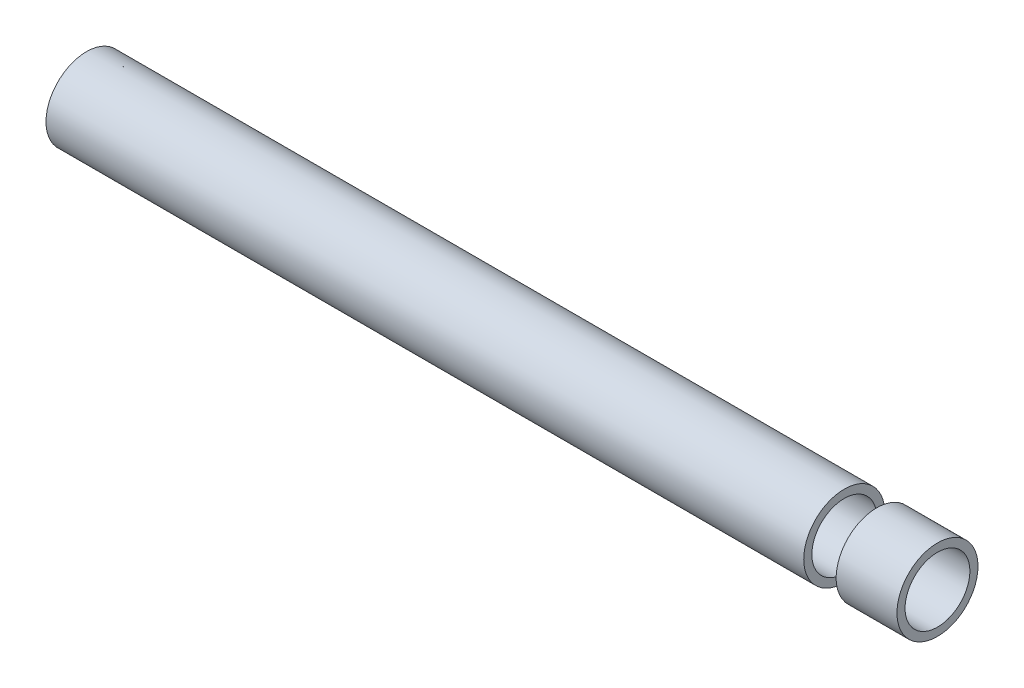
from build123d import *

# Parameters (mm, degrees)
SKETCH1_R               = 15.875
SKETCH1_R_2             = 12.7
EXTRUDE_THIN1_DEPTH     = 166.671625
CUT_EXTRUDE1_DEPTH      = 169.176876621
CUT_EXTRUDE1_DEPTH_BACK = 169.176876621
SKETCH2_W               = 12.7
SKETCH2_H               = 31.75


with BuildPart() as part:
    # Sketch1 → Extrude-Thin1 (new, symmetric)
    with BuildSketch(Plane(origin=(0, 0, 0), x_dir=(0, 0, -1), z_dir=(1, 0, 0))):
        Circle(SKETCH1_R)
        Circle(SKETCH1_R_2, mode=Mode.SUBTRACT)
    extrude(amount=EXTRUDE_THIN1_DEPTH, both=True)

    # Sketch2 → Cut-Extrude1 (cut, two sides: drawn at the far end of the back side and taken through both)
    with BuildSketch(Plane.XY.offset(-CUT_EXTRUDE1_DEPTH_BACK)):
        with Locations((136.509125, 0)):
            Rectangle(SKETCH2_W, SKETCH2_H)
    extrude(amount=CUT_EXTRUDE1_DEPTH + CUT_EXTRUDE1_DEPTH_BACK, mode=Mode.SUBTRACT)


with BuildPart() as cut_extrude1_piece_1:
    # of the separate pieces the step leaves, piece 1, a body of its own (cut_extrude1_pieces)
    add(part.part.solids().sort_by_distance((-166.671625, 0, -15.875))[0])


with BuildPart() as cut_extrude1_piece_2:
    # of the separate pieces the step leaves, piece 2, a body of its own (cut_extrude1_pieces)
    add(part.part.solids().sort_by_distance((142.859125, 0, -15.875))[0])


solid = Compound([cut_extrude1_piece_1.part, cut_extrude1_piece_2.part])
